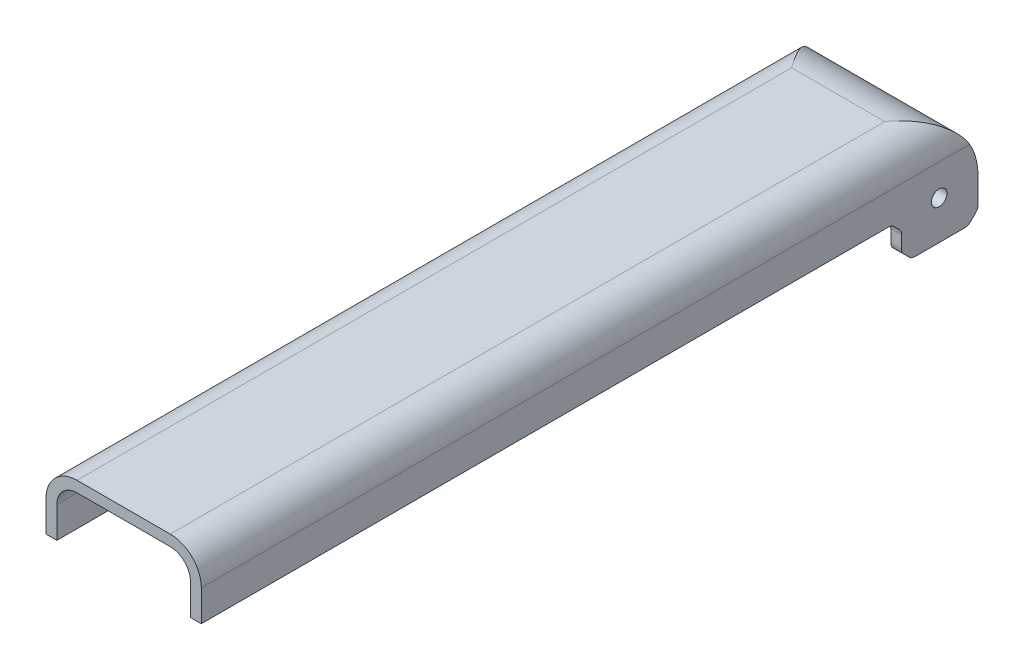
from build123d import *

# Parameters (mm, degrees)
BOSS_EXTRUDE1_DEPTH = 250
BOSS_EXTRUDE3_START = -50
BOSS_EXTRUDE3_DEPTH = 50
CUT_EXTRUDE1_DEPTH  = 50
BOSS_EXTRUDE4_DEPTH = 50
CUT_EXTRUDE2_DEPTH  = 256.734237176
SKETCH8_W           = 43
SKETCH8_H           = 25.762038467
CUT_EXTRUDE3_DEPTH  = 12.5
CUT_EXTRUDE4_START  = -80
CUT_EXTRUDE4_DEPTH  = 80
FILLET1_R           = 2.5
BOSS_EXTRUDE5_DEPTH = 250
CUT_EXTRUDE5_START  = -33.39669099
CUT_EXTRUDE5_DEPTH  = 16.79338188
CUT_EXTRUDE6_START  = -33.39669099
CUT_EXTRUDE6_DEPTH  = 16.79338198


# Read off the part's stored shape, not the designer's step: Boss-Extrude3, Cut-Extrude5, Cut-Extrude6
with BuildPart() as part:
    # Sketch2 → Boss-Extrude1 (new body)
    with BuildSketch(Plane.XY):
        with BuildLine():
            Line((0, 0), (0, 10))
            ThreePointArc((0, 10), (2.928932188, 17.071067812), (10, 20))
            Line((10, 20), (40, 20))
            ThreePointArc((40, 20), (47.071067812, 17.071067812), (50, 10))
            Line((50, 10), (50, 0))
            Line((50, 0), (46.5, 0))
            Line((46.5, 0), (46.5, 10))
            ThreePointArc((46.5, 10), (44.596194078, 14.596194078), (40, 16.5))
            Line((40, 16.5), (10, 16.5))
            ThreePointArc((10, 16.5), (5.403805922, 14.596194078), (3.5, 10))
            Line((3.5, 10), (3.5, 0))
            Line((3.5, 0), (0, 0))
        make_face()
    extrude(amount=BOSS_EXTRUDE1_DEPTH)

    # Boss-Extrude3 outline → Boss-Extrude3 (add)
    with BuildSketch(Plane(origin=(50, 0, 0), x_dir=(0, 0, -1), z_dir=(1, 0, 0)).offset(BOSS_EXTRUDE3_START)):
        with BuildLine():
            Line((-3.182644966, -12.5), (0, -9.317355034))
            Line((0, -9.317355034), (0, 0))
            Line((0, 0), (-10, 0))
            ThreePointArc((-10, 0), (-12.5, 2.5), (-15, 0))
            Line((-15, 0), (-27.762038467, 0))
            Line((-27.762038467, 0), (-24.579393501, -3.182644966))
            Line((-24.579393501, -3.182644966), (-24.579393501, -9.317355034))
            Line((-24.579393501, -9.317355034), (-21.396748534, -12.5))
            Line((-21.396748534, -12.5), (-3.182644966, -12.5))
        make_face()
    extrude(amount=BOSS_EXTRUDE3_DEPTH)

    # Sketch5 → Cut-Extrude1 (cut)
    with BuildSketch(Plane(origin=(50, 0, 0), x_dir=(0, 0, -1), z_dir=(1, 0, 0))):
        with BuildLine():
            Line((-2.679491924, 10), (0, 10))
            Line((0, 10), (0, 20))
            Line((0, 20), (-20, 20))
            ThreePointArc((-20, 20), (-10, 17.320508076), (-2.679491924, 10))
        make_face()
        with BuildLine():
            ThreePointArc((-2.679491924, 10), (-0.681483474, 5.176380902), (0, 0))
            Line((0, 0), (0, 10))
            Line((0, 10), (-2.679491924, 10))
        make_face()
    extrude(amount=-CUT_EXTRUDE1_DEPTH, mode=Mode.SUBTRACT)

    # Sketch6 → Boss-Extrude4 (add)
    with BuildSketch(Plane(origin=(50, 0, 0), x_dir=(0, 0, -1), z_dir=(1, 0, 0))):
        with BuildLine():
            Line((0, 0), (-2, 0))
            ThreePointArc((-2, 0), (-7.272077939, 12.727922061), (-20, 18))
            Line((-20, 18), (-20, 20))
            ThreePointArc((-20, 20), (-5.857864376, 14.142135624), (0, 0))
        make_face()
    extrude(amount=-BOSS_EXTRUDE4_DEPTH)

    # Sketch7 → Cut-Extrude2 (cut, through all)
    with BuildSketch(Plane.XY.offset(250)):
        with BuildLine():
            Line((55.315480724, 1.557102667), (50, 0))
            Line((50, 0), (50, 10))
            ThreePointArc((50, 10), (47.071067812, 17.071067812), (40, 20))
            Line((40, 20), (10, 20))
            ThreePointArc((10, 20), (2.928932188, 17.071067812), (0, 10))
            Line((0, 10), (0, 0))
            Line((0, 0), (-9.288267342, 0))
            Line((-9.288267342, 0), (-7.589565667, 19.446554679))
            Line((-7.589565667, 19.446554679), (-2.440376216, 23.109380165))
            Line((-2.440376216, 23.109380165), (52.555090503, 23.109380165))
            Line((52.555090503, 23.109380165), (55.315480724, 10.793793023))
            Line((55.315480724, 10.793793023), (55.315480724, 1.557102667))
        make_face()
    extrude(amount=-CUT_EXTRUDE2_DEPTH, mode=Mode.SUBTRACT)

    # Sketch8 → Cut-Extrude3 (cut)
    with BuildSketch(Plane.XZ.offset(12.5)):
        with Locations((25, 14.881019233)):
            Rectangle(SKETCH8_W, SKETCH8_H)
    extrude(amount=-CUT_EXTRUDE3_DEPTH, mode=Mode.SUBTRACT)

    # Sketch9 → Cut-Extrude4 (cut)
    with BuildSketch(Plane(origin=(50, 0, 0), x_dir=(0, 0, -1), z_dir=(1, 0, 0)).offset(CUT_EXTRUDE4_START)):
        with BuildLine():
            ThreePointArc((-10, 0), (-12.5, 2.5), (-15, 0))
            Line((-15, 0), (-14.893392212, 0))
            Line((-14.893392212, 0), (-12.5, 0))
            Line((-12.5, 0), (-10, 0))
        make_face()
        with BuildLine():
            ThreePointArc((-10, 0), (-12.5, 2.5), (-15, 0))
            Line((-15, 0), (-14.893392212, 0))
            Line((-14.893392212, 0), (-12.5, 0))
            Line((-12.5, 0), (-10, 0))
        make_face()
        with BuildLine():
            Line((-14.893392212, 0), (-15, 0))
            ThreePointArc((-15, 0), (-12.5, -2.5), (-10, 0))
            Line((-10, 0), (-12.5, 0))
            Line((-12.5, 0), (-14.893392212, 0))
        make_face()
    extrude(amount=CUT_EXTRUDE4_DEPTH, mode=Mode.SUBTRACT)

    # Fillet1
    fillet1_edges = [part.edges().sort_by_distance(p)[0] for p in [
        (48.25, -3.182644966, 24.579393501),
        (48.25, -9.317355034, 24.579393501),
        (48.25, -12.5, 21.396748534),
        (48.25, -12.5, 3.182644966),
        (1.75, 0, 27.762038467),
        (1.75, -3.182644966, 24.579393501),
        (48.25, 0, 27.762038467),
        (25, -9.317355034, 0),
        (1.75, -12.5, 3.182644966),
        (1.75, -12.5, 21.396748534),
        (1.75, -9.317355034, 24.579393501),
    ]]
    fillet(fillet1_edges, radius=FILLET1_R)

    # Sketch11 → Boss-Extrude5 (add)
    with BuildSketch(Plane.XY.offset(250)):
        with BuildLine():
            Line((33.39669089, 16.5), (25, 16.5))
            Line((25, 16.5), (25, 11.5))
            ThreePointArc((25, 11.5), (27.424332471, 12.127059105), (29.240585043, 13.850955173))
            add(Edge.make_bspline(
                [(33.39669089, 16.5), (30.786023125, 16.321433546), (29.240585043, 13.850955173)],
                knots=[0, 0, 0, 1, 1, 1], degree=2))
        make_face()
        with BuildLine():
            Line((25, 11.5), (25, 16.5))
            Line((25, 16.5), (16.60330911, 16.5))
            add(Edge.make_bspline(
                [(16.60330911, 16.5), (19.213976875, 16.321433546), (20.759414957, 13.850955173)],
                knots=[0, 0, 0, 1, 1, 1], degree=2))
            ThreePointArc((20.759414957, 13.850955173), (22.575667529, 12.127059105), (25, 11.5))
        make_face()
    extrude(amount=-BOSS_EXTRUDE5_DEPTH)

    # Cut-Extrude5 outline → Cut-Extrude5 (cut)
    with BuildSketch(Plane(origin=(50, 0, 0), x_dir=(0, 0, -1), z_dir=(1, 0, 0)).offset(CUT_EXTRUDE5_START)):
        with BuildLine():
            Line((3.259725814, 21.536498362), (-20, 20))
            ThreePointArc((-20, 20), (-14.083920217, 19.104973175), (-8.697345445, 16.5))
            ThreePointArc((-8.697345445, 16.5), (-5.32403803, 13.587352216), (-2.679491924, 10))
            Line((-2.679491924, 10), (3.666220077, 8.833552657))
            Line((3.666220077, 8.833552657), (4.936514647, 14.11797807))
            Line((4.936514647, 14.11797807), (3.259725814, 21.536498362))
        make_face()
    extrude(amount=CUT_EXTRUDE5_DEPTH, mode=Mode.SUBTRACT)

    # Cut-Extrude6 outline → Cut-Extrude6 (cut)
    with BuildSketch(Plane(origin=(50, 0, 0), x_dir=(0, 0, -1), z_dir=(1, 0, 0)).offset(CUT_EXTRUDE6_START)):
        with BuildLine():
            Line((-250, 10), (-243.5, 10))
            add(Edge.make_bspline(
                [(-243.5, 10), (-243.489525842, 13.29527732), (-245.567830826, 16.47951056), (-250, 16.5)],
                knots=[0, 0, 0, 0, 1, 1, 1, 1], degree=3))
            Line((-250, 16.5), (-250, 10))
        make_face()
    extrude(amount=CUT_EXTRUDE6_DEPTH, mode=Mode.SUBTRACT)


solid = part.part
